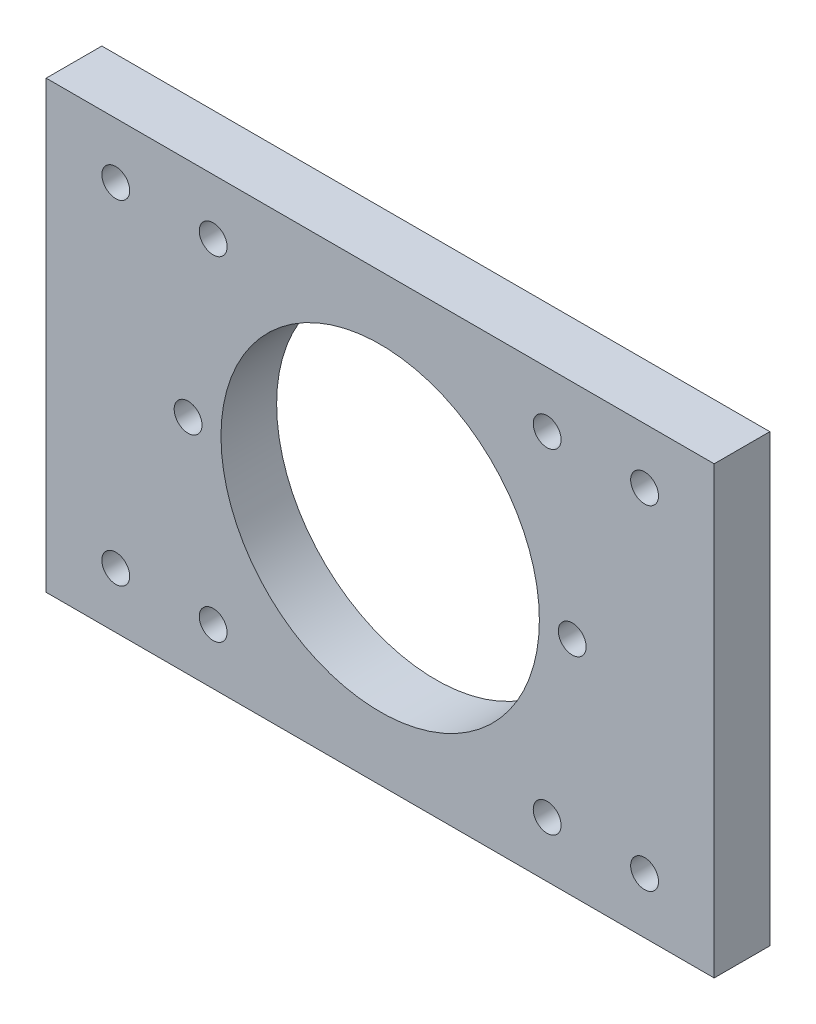
from build123d import *

# Parameters (mm, degrees)
SKETCH1_W               = 76.2
SKETCH1_H               = 50.8
BOSS_EXTRUDE1_DEPTH     = 6.35
CAVITY5_OUTLINE_R       = 18.161
CAVITY5_OUTLINE_R_2     = 1.5875
CAVITY5_DEPTH           = 6.35
SKETCH3_R               = 1.5875
CUT_EXTRUDE1_DEPTH      = 92.800885072
MIRROR2_COPY_1_SKETCH_R = 1.5875
MIRROR2_COPY_1_DEPTH    = 92.800885072
SKETCH4_R               = 1.5875
CUT_EXTRUDE2_DEPTH      = 92.800885072


# Read off the part's stored shape, not the designer's step: Cavity5
with BuildPart() as part:
    # Sketch1 → Boss-Extrude1 (new body)
    with BuildSketch(Plane.XY):
        with Locations((38.1, 25.4)):
            Rectangle(SKETCH1_W, SKETCH1_H)
    extrude(amount=BOSS_EXTRUDE1_DEPTH)

    # Cavity5 outline → Cavity5 (cut)
    with BuildSketch(Plane.XY):
        with Locations((38.1, 25.4)):
            Circle(CAVITY5_OUTLINE_R)
        with Locations((16.188175065, 25.4)):
            Circle(CAVITY5_OUTLINE_R_2)
        with Locations((60.011824935, 25.4)):
            Circle(CAVITY5_OUTLINE_R_2)
    extrude(amount=CAVITY5_DEPTH, mode=Mode.SUBTRACT)

    # Sketch3 → Cut-Extrude1 (cut, through all)
    with BuildSketch(Plane(origin=(0, 0, 0), x_dir=(-1, 0, 0), z_dir=(0, 0, -1))):
        with Locations((-68.2625, 44.45)):
            Circle(SKETCH3_R)
    cut_extrude1 = extrude(amount=-CUT_EXTRUDE1_DEPTH, mode=Mode.SUBTRACT)

    # Mirror1: Cut-Extrude1 across plane
    add(cut_extrude1.mirror(Plane(origin=(38.1, 0, 0), x_dir=(0, 0, 1), z_dir=(1, 0, 0))), mode=Mode.SUBTRACT)

    # Mirror2: Cut-Extrude1 across plane
    add(cut_extrude1.mirror(Plane.ZX.offset(25.4)), mode=Mode.SUBTRACT)

    # Mirror2 copy 1 sketch → Mirror2 copy 1 (cut, through all)
    with BuildSketch(Plane(origin=(76.2, 50.8, 0), x_dir=(1, 0, 0), z_dir=(0, 0, -1))):
        with Locations((-68.2625, 44.45)):
            Circle(MIRROR2_COPY_1_SKETCH_R)
    extrude(amount=-MIRROR2_COPY_1_DEPTH, mode=Mode.SUBTRACT)

    # Sketch4 → Cut-Extrude2 (cut, through all)
    with BuildSketch(Plane(origin=(0, 0, 0), x_dir=(-1, 0, 0), z_dir=(0, 0, -1))):
        with Locations((-19.05, 44.45)):
            Circle(SKETCH4_R)
        with Locations((-57.15, 44.45)):
            Circle(SKETCH4_R)
        with Locations((-57.15, 6.35)):
            Circle(SKETCH4_R)
        with Locations((-19.05, 6.35)):
            Circle(SKETCH4_R)
    extrude(amount=-CUT_EXTRUDE2_DEPTH, mode=Mode.SUBTRACT)


solid = part.part
